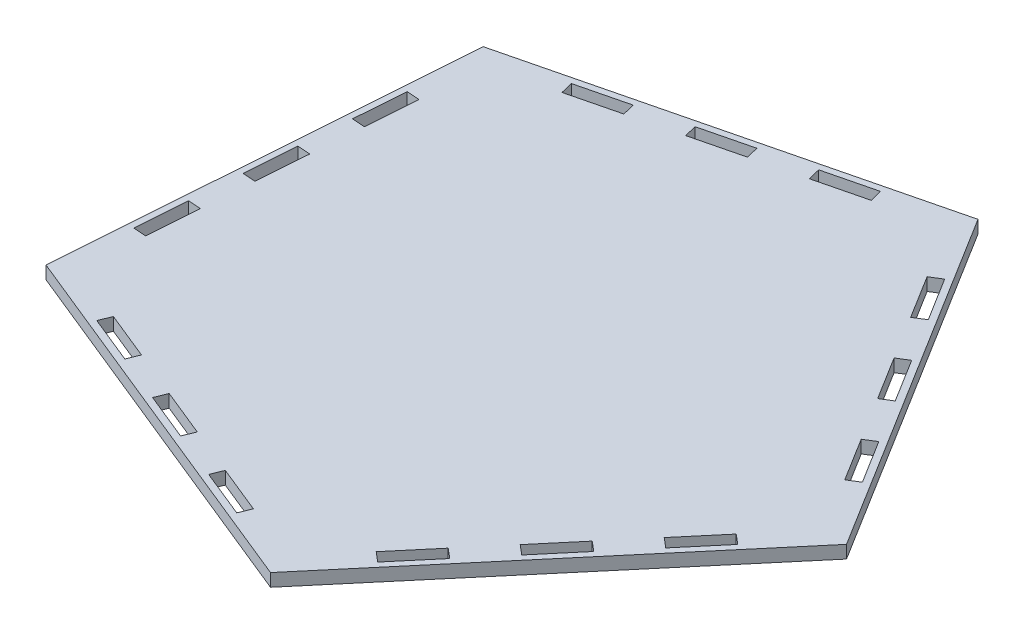
from build123d import *

# Parameters (mm, degrees)
BOSS_EXTRUDE1_DEPTH = 6.35
CUT_EXTRUDE1_DEPTH  = 816.405571916
CUT_EXTRUDE2_DEPTH  = 816.405571916
CUT_EXTRUDE3_DEPTH  = 816.405571916
CUT_EXTRUDE4_DEPTH  = 816.405571916
CUT_EXTRUDE5_DEPTH  = 816.405571916


with BuildPart() as part:
    # Sketch1 → Boss-Extrude1 (new body)
    with BuildSketch(Plane(origin=(0, 0, 0), x_dir=(1, 0, 0), z_dir=(0, 1, 0))):
        Polygon((-472.762098838, -38.601599313), (-579.996957803, 133.998878735), (-777.287160977, 85.348948297), (-791.984353221, -117.318840313), (-603.777514393, -193.924491661), align=None)
    extrude(amount=BOSS_EXTRUDE1_DEPTH)

    # Sketch2 → Cut-Extrude1 (cut, through all)
    with BuildSketch(Plane(origin=(0, 6.35, 0), x_dir=(1, 0, 0), z_dir=(0, 1, 0))):
        Polygon((-659.001261619, -161.163030045), (-635.475406766, -170.738736463), (-637.86933337, -176.620200176), (-661.395188224, -167.044493758), align=None)
        Polygon((-706.052971326, -142.011617208), (-682.527116473, -151.587323626), (-684.921043077, -157.46878734), (-708.446897931, -147.893080921), align=None)
        Polygon((-753.053854552, -122.735332494), (-729.527999698, -132.311038913), (-731.921926303, -138.192502626), (-755.447781156, -128.616796208), align=None)
    extrude(amount=-CUT_EXTRUDE1_DEPTH, mode=Mode.SUBTRACT)

    # Sketch4 → Cut-Extrude2 (cut, through all)
    with BuildSketch(Plane(origin=(0, 6.35, 0), x_dir=(1, 0, 0), z_dir=(0, 1, 0))):
        Polygon((-570.115957611, -139.244740198), (-565.262117225, -143.338971934), (-581.639044169, -162.754333478), (-586.492884555, -158.660101741), align=None)
        Polygon((-520.985176778, -80.998655568), (-516.131336392, -85.092887304), (-499.754409447, -65.677525761), (-504.608249833, -61.583294024), align=None)
        Polygon((-548.88519028, -123.923610391), (-532.508263336, -104.508248847), (-537.362103722, -100.414017111), (-553.739030666, -119.829378655), align=None)
    extrude(amount=-CUT_EXTRUDE2_DEPTH, mode=Mode.SUBTRACT)

    # Sketch5 → Cut-Extrude3 (cut, through all)
    with BuildSketch(Plane(origin=(0, 6.35, 0), x_dir=(1, 0, 0), z_dir=(0, 1, 0))):
        Polygon((-777.891428053, -54.674087259), (-784.224796447, -54.214800001), (-786.061945478, -79.548273578), (-779.728577084, -80.007560835), align=None)
        Polygon((-774.217129992, -4.007140106), (-780.550498387, -3.547852849), (-782.387647417, -28.881326425), (-776.054279023, -29.340613683), align=None)
        Polygon((-776.876200326, 47.119094304), (-770.542831932, 46.659807046), (-772.379980962, 21.32633347), (-778.713349356, 21.785620727), align=None)
    extrude(amount=-CUT_EXTRUDE3_DEPTH, mode=Mode.SUBTRACT)

    # Sketch6 → Cut-Extrude4 (cut, through all)
    with BuildSketch(Plane(origin=(0, 6.35, 0), x_dir=(1, 0, 0), z_dir=(0, 1, 0))):
        Polygon((-508.969874734, 13.660505405), (-495.565517364, -7.914554351), (-500.959282303, -11.265643693), (-514.363639673, 10.309416063), align=None)
        Polygon((-522.374232105, 35.235565162), (-527.767997044, 31.884475819), (-541.172354415, 53.459535575), (-535.778589476, 56.810624918), align=None)
        Polygon((-549.139796727, 78.412493389), (-554.533561666, 75.061404046), (-567.937919036, 96.636463802), (-562.544154097, 99.987553145), align=None)
    extrude(amount=-CUT_EXTRUDE4_DEPTH, mode=Mode.SUBTRACT)

    # Sketch7 → Cut-Extrude5 (cut, through all)
    with BuildSketch(Plane(origin=(0, 6.35, 0), x_dir=(1, 0, 0), z_dir=(0, 1, 0))):
        Polygon((-614.708405409, 115.629038504), (-639.369680806, 109.5477972), (-640.889991132, 115.713116049), (-616.228715735, 121.794357354), align=None)
        Polygon((-665.551266529, 109.631874744), (-690.212541925, 103.550633439), (-688.692231599, 97.38531459), (-664.030956203, 103.466555895), align=None)
        Polygon((-714.873817322, 97.469392134), (-739.535092719, 91.38815083), (-738.014782393, 85.22283198), (-713.353506996, 91.304073285), align=None)
    extrude(amount=-CUT_EXTRUDE5_DEPTH, mode=Mode.SUBTRACT)


solid = part.part
